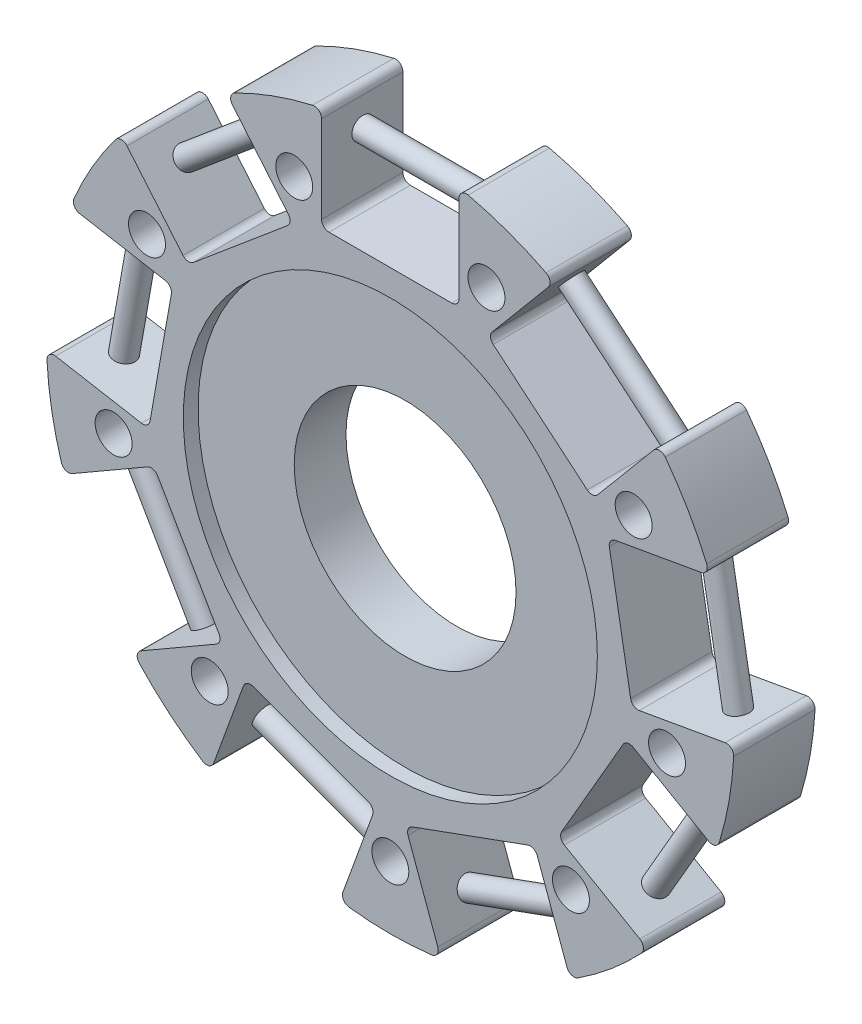
from build123d import *

# Parameters (mm, degrees)
BOSS_EXTRUDE1_DEPTH = 11
SKETCH3_R           = 2.5
CUT_EXTRUDE4_DEPTH  = 11
SKETCH7_R           = 28
CUT_EXTRUDE5_DEPTH  = 2
CUT_EXTRUDE6_START  = -2
SKETCH10_R          = 28
CUT_EXTRUDE6_DEPTH  = 2
SKETCH12_R          = 15
CUT_EXTRUDE7_DEPTH  = 67.332794625
SKETCH13_R          = 1.5
BOSS_EXTRUDE2_DEPTH = 18.5
CIRPATTERN1_COUNT   = 9


with BuildPart() as part:
    # Sketch1 → Boss-Extrude1 (new body)
    with BuildSketch(Plane.XY):
        with BuildLine():
            Line((8.3, 31.537634409), (-8.3, 31.537634409))
            ThreePointArc((-8.3, 31.537634409), (-9.007106781, 31.830527627), (-9.3, 32.537634409))
            Line((-9.3, 32.537634409), (-9.3, 44.322482838))
            ThreePointArc((-9.3, 44.322482838), (-9.67804984, 45.105539668), (-10.526355997, 45.296527479))
            ThreePointArc((-10.526355997, 45.296527479), (-15.905148665, 43.699036811), (-21.052390107, 41.465364378))
            ThreePointArc((-21.052390107, 41.465364378), (-21.579465726, 40.773778539), (-21.365729478, 39.930916453))
            Line((-21.365729478, 39.930916453), (-13.790574925, 30.903198801))
            ThreePointArc((-13.790574925, 30.903198801), (-13.56042467, 30.173255449), (-13.913831759, 29.494366748))
            Line((-13.913831759, 29.494366748), (-26.630169515, 18.824092427))
            ThreePointArc((-26.630169515, 18.824092427), (-27.360112867, 18.593942172), (-28.039001567, 18.947349261))
            Line((-28.039001567, 18.947349261), (-35.61415612, 27.975066913))
            ThreePointArc((-35.61415612, 27.975066913), (-36.407098327, 28.331917493), (-37.179703143, 27.932941958))
            ThreePointArc((-37.179703143, 27.932941958), (-40.273250169, 23.251771826), (-42.780488909, 18.232096448))
            ThreePointArc((-42.780488909, 18.232096448), (-42.73970945, 17.363513283), (-42.034196679, 16.855230478))
            Line((-42.034196679, 16.855230478), (-30.428386578, 14.808813024))
            ThreePointArc((-30.428386578, 14.808813024), (-29.782882711, 14.397581707), (-29.617227003, 13.650357093))
            Line((-29.617227003, 13.650357093), (-32.499786752, -2.697451607))
            ThreePointArc((-32.499786752, -2.697451607), (-32.911018069, -3.342955474), (-33.658242683, -3.508611182))
            Line((-33.658242683, -3.508611182), (-45.264052784, -1.462193729))
            ThreePointArc((-45.264052784, -1.462193729), (-46.100860887, -1.698523751), (-46.436253982, -2.500777546))
            ThreePointArc((-46.436253982, -2.500777546), (-45.797050331, -8.07525561), (-44.491121499, -13.532172037))
            ThreePointArc((-44.491121499, -13.532172037), (-43.901568124, -14.171332813), (-43.034396096, -14.107205164))
            Line((-43.034396096, -14.107205164), (-32.828417977, -8.214780949))
            ThreePointArc((-32.828417977, -8.214780949), (-32.069598932, -8.114880527), (-31.462392573, -8.580806353))
            Line((-31.462392573, -8.580806353), (-23.162392573, -22.956828056))
            ThreePointArc((-23.162392573, -22.956828056), (-23.062492151, -23.715647101), (-23.528417977, -24.322853459))
            Line((-23.528417977, -24.322853459), (-33.734396096, -30.215277674))
            ThreePointArc((-33.734396096, -30.215277674), (-34.223518284, -30.934206854), (-33.964765501, -31.764355442))
            ThreePointArc((-33.964765501, -31.764355442), (-29.891901666, -35.6237812), (-25.383863875, -38.964586832))
            ThreePointArc((-25.383863875, -38.964586832), (-24.52139516, -39.075254789), (-23.898323306, -38.468722725))
            Line((-23.898323306, -38.468722725), (-19.867667757, -27.394587619))
            ThreePointArc((-19.867667757, -27.394587619), (-19.350593398, -26.830299975), (-18.585954993, -26.796915141))
            Line((-18.585954993, -26.796915141), (-2.987057488, -32.47444952))
            ThreePointArc((-2.987057488, -32.47444952), (-2.422769844, -32.991523879), (-2.389385011, -33.756162285))
            Line((-2.389385011, -33.756162285), (-6.420040559, -44.830297391))
            ThreePointArc((-6.420040559, -44.830297391), (-6.332611124, -45.695430776), (-5.600785766, -46.165038406))
            ThreePointArc((-5.600785766, -46.165038406), (0, -46.503543652), (5.600785766, -46.165038406))
            ThreePointArc((5.600785766, -46.165038406), (6.332611124, -45.695430776), (6.420040559, -44.830297391))
            Line((6.420040559, -44.830297391), (2.389385011, -33.756162285))
            ThreePointArc((2.389385011, -33.756162285), (2.422769844, -32.991523879), (2.987057488, -32.47444952))
            Line((2.987057488, -32.47444952), (18.585954993, -26.796915141))
            ThreePointArc((18.585954993, -26.796915141), (19.350593398, -26.830299975), (19.867667757, -27.394587619))
            Line((19.867667757, -27.394587619), (23.898323306, -38.468722725))
            ThreePointArc((23.898323306, -38.468722725), (24.52139516, -39.075254789), (25.383863875, -38.964586832))
            ThreePointArc((25.383863875, -38.964586832), (29.891901666, -35.6237812), (33.964765501, -31.764355442))
            ThreePointArc((33.964765501, -31.764355442), (34.223518284, -30.934206854), (33.734396096, -30.215277674))
            Line((33.734396096, -30.215277674), (23.528417977, -24.322853459))
            ThreePointArc((23.528417977, -24.322853459), (23.062492151, -23.715647101), (23.162392573, -22.956828056))
            Line((23.162392573, -22.956828056), (31.462392573, -8.580806353))
            ThreePointArc((31.462392573, -8.580806353), (32.069598932, -8.114880527), (32.828417977, -8.214780949))
            Line((32.828417977, -8.214780949), (43.034396096, -14.107205164))
            ThreePointArc((43.034396096, -14.107205164), (43.901568124, -14.171332813), (44.491121499, -13.532172037))
            ThreePointArc((44.491121499, -13.532172037), (45.797050331, -8.07525561), (46.436253982, -2.500777546))
            ThreePointArc((46.436253982, -2.500777546), (46.100860887, -1.698523751), (45.264052784, -1.462193729))
            Line((45.264052784, -1.462193729), (33.658242683, -3.508611182))
            ThreePointArc((33.658242683, -3.508611182), (32.911018069, -3.342955474), (32.499786752, -2.697451607))
            Line((32.499786752, -2.697451607), (29.617227003, 13.650357093))
            ThreePointArc((29.617227003, 13.650357093), (29.782882711, 14.397581707), (30.428386578, 14.808813024))
            Line((30.428386578, 14.808813024), (42.034196679, 16.855230478))
            ThreePointArc((42.034196679, 16.855230478), (42.73970945, 17.363513283), (42.780488909, 18.232096448))
            ThreePointArc((42.780488909, 18.232096448), (40.273250169, 23.251771826), (37.179703143, 27.932941958))
            ThreePointArc((37.179703143, 27.932941958), (36.407098327, 28.331917493), (35.61415612, 27.975066913))
            Line((35.61415612, 27.975066913), (28.039001567, 18.947349261))
            ThreePointArc((28.039001567, 18.947349261), (27.360112867, 18.593942172), (26.630169515, 18.824092427))
            Line((26.630169515, 18.824092427), (13.913831759, 29.494366748))
            ThreePointArc((13.913831759, 29.494366748), (13.56042467, 30.173255449), (13.790574925, 30.903198801))
            Line((13.790574925, 30.903198801), (21.365729478, 39.930916453))
            ThreePointArc((21.365729478, 39.930916453), (21.579465726, 40.773778539), (21.052390107, 41.465364378))
            ThreePointArc((21.052390107, 41.465364378), (15.905148665, 43.699036811), (10.526355997, 45.296527479))
            ThreePointArc((10.526355997, 45.296527479), (9.67804984, 45.105539668), (9.3, 44.322482838))
            Line((9.3, 44.322482838), (9.3, 32.537634409))
            ThreePointArc((9.3, 32.537634409), (9.007106781, 31.830527627), (8.3, 31.537634409))
        make_face()
    extrude(amount=BOSS_EXTRUDE1_DEPTH)

    # Sketch3 → Cut-Extrude4 (cut)
    with BuildSketch(Plane.XY.offset(11)):
        with Locations((12.996765446, 35.70831959)):
            Circle(SKETCH3_R)
        with Locations((-12.996765446, 35.70831959)):
            Circle(SKETCH3_R)
        with Locations((32.908965344, 19)):
            Circle(SKETCH3_R)
        with Locations((37.422694614, -6.598630751)):
            Circle(SKETCH3_R)
        with Locations((24.425929168, -29.109688839)):
            Circle(SKETCH3_R)
        with Locations((0, -38)):
            Circle(SKETCH3_R)
        with Locations((-24.425929168, -29.109688839)):
            Circle(SKETCH3_R)
        with Locations((-37.422694614, -6.598630751)):
            Circle(SKETCH3_R)
        with Locations((-32.908965344, 19)):
            Circle(SKETCH3_R)
    extrude(amount=-CUT_EXTRUDE4_DEPTH, mode=Mode.SUBTRACT)

    # Sketch7 → Cut-Extrude5 (cut)
    with BuildSketch(Plane.XY.offset(11)):
        Circle(SKETCH7_R)
    extrude(amount=-CUT_EXTRUDE5_DEPTH, mode=Mode.SUBTRACT)

    # Sketch10 → Cut-Extrude6 (cut)
    with BuildSketch(Plane(origin=(0, 0, 0), x_dir=(-1, 0, 0), z_dir=(0, 0, -1)).offset(CUT_EXTRUDE6_START)):
        Circle(SKETCH10_R)
    extrude(amount=CUT_EXTRUDE6_DEPTH, mode=Mode.SUBTRACT)

    # Sketch12 → Cut-Extrude7 (cut, through all)
    with BuildSketch(Plane(origin=(0, 0, 2), x_dir=(-1, 0, 0), z_dir=(0, 0, -1))):
        Circle(SKETCH12_R)
    extrude(amount=-CUT_EXTRUDE7_DEPTH, mode=Mode.SUBTRACT)

    # Sketch13 → Boss-Extrude2 (add)
    with BuildSketch(Plane(origin=(7.124213321, -5.97792477, 0), x_dir=(0, 0, 1), z_dir=(-0.7660444431189782, 0.6427876096865393, 0))):
        with Locations((5.5, 40.537634409)):
            Circle(SKETCH13_R)
    boss_extrude2 = extrude(amount=BOSS_EXTRUDE2_DEPTH)

    # CirPattern1: Boss-Extrude2 ×9 about axis
    cirpattern1_axis = Axis((0, 0, 0), (0, 0, -1))
    for i in range(1, CIRPATTERN1_COUNT):
        add(boss_extrude2.rotate(cirpattern1_axis, i * 360 / CIRPATTERN1_COUNT))


solid = part.part
